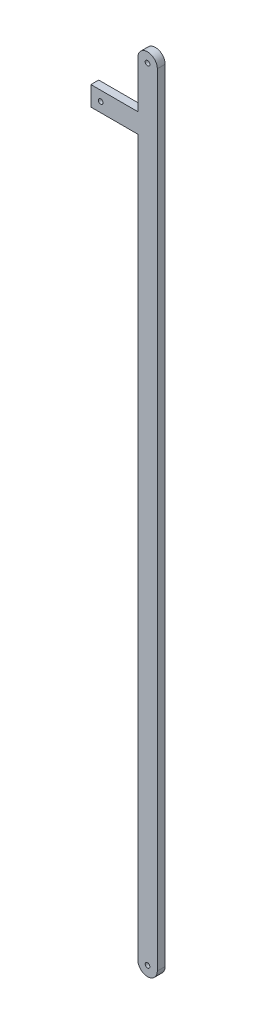
from build123d import *

# Parameters (mm, degrees)
SKETCH1_R           = 3
BOSS_EXTRUDE1_DEPTH = 10


with BuildPart() as part:
    # Sketch1 → Boss-Extrude1 (new body)
    with BuildSketch(Plane.XY):
        with BuildLine():
            Line((-12.5, 0), (-12.5, -60))
            Line((-12.5, -60), (-72.5, -60))
            Line((-72.5, -60), (-72.5, -85))
            Line((-72.5, -85), (-12.5, -85))
            Line((-12.5, -85), (-12.5, -1000))
            ThreePointArc((-12.5, -1000), (0, -1012.5), (12.5, -1000))
            Line((12.5, -1000), (12.5, 0))
            ThreePointArc((12.5, 0), (0, 12.5), (-12.5, 0))
        make_face()
        Circle(SKETCH1_R, mode=Mode.SUBTRACT)
        with Locations((0, -1000)):
            Circle(SKETCH1_R, mode=Mode.SUBTRACT)
        with Locations((-60, -72.5)):
            Circle(SKETCH1_R, mode=Mode.SUBTRACT)
    extrude(amount=BOSS_EXTRUDE1_DEPTH)


solid = part.part
